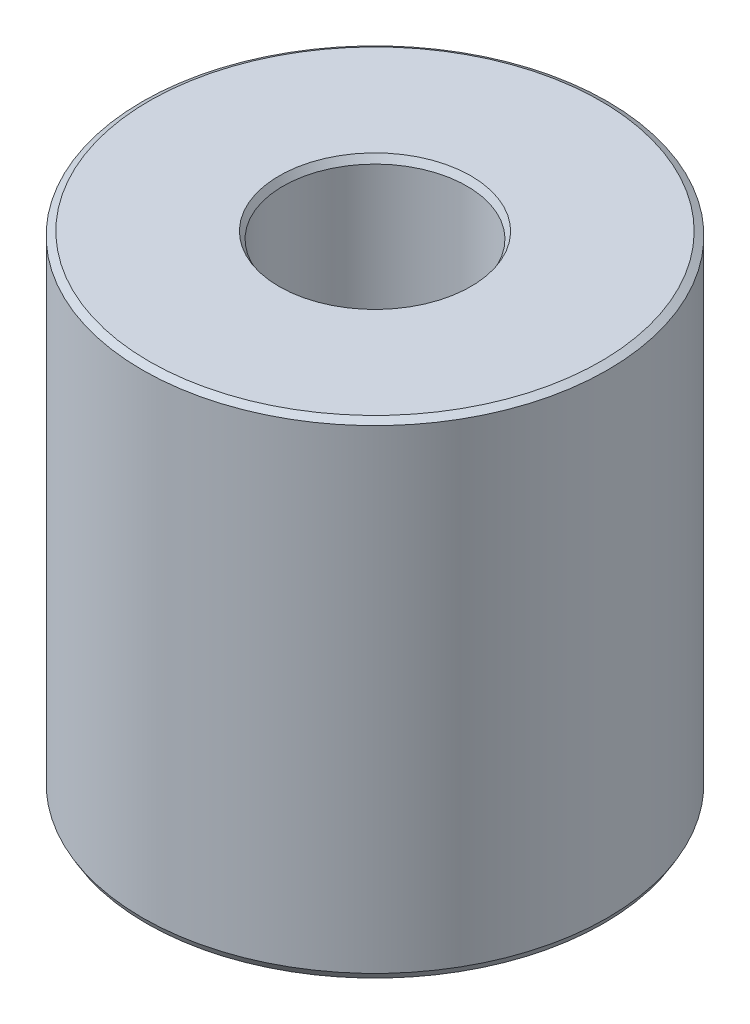
from build123d import *
from OCP.BRepFilletAPI import BRepFilletAPI_MakeChamfer

# Parameters (mm, degrees)
SKETCH1_R           = 50
BOSS_EXTRUDE1_DEPTH = 104.31964153
SKETCH2_R           = 19.763940978
CUT_EXTRUDE1_DEPTH  = 127.026138594
CHAMFER1_SIZE       = 0.853859272
CHAMFER1_SIZE2      = 1.478927642


with BuildPart() as part:
    # Sketch1 → Boss-Extrude1 (new body)
    with BuildSketch(Plane(origin=(0, 0, 0), x_dir=(1, 0, 0), z_dir=(0, 1, 0))):
        Circle(SKETCH1_R)
    extrude(amount=BOSS_EXTRUDE1_DEPTH)

    # Sketch2 → Cut-Extrude1 (cut, through all)
    with BuildSketch(Plane(origin=(0, 0, 0), x_dir=(1, 0, 0), z_dir=(0, 1, 0))):
        Circle(SKETCH2_R)
    extrude(amount=CUT_EXTRUDE1_DEPTH, mode=Mode.SUBTRACT)

    # Chamfer1: one chamfer whose edges measure the first distance from different faces: ONE call of the kernel's chamfer builder (chamfer() names one face for all edges)
    chamfer1_edges_1 = [part.edges().sort_by_distance(p)[0] for p in [
        (-19.763940978, 104.31964153, 0),
    ]]
    chamfer1_side_1 = [part.faces().sort_by_distance(p)[0] for p in [
        (-48.585786438, 104.31964153, 0),
    ]]
    chamfer1_edges_2 = [part.edges().sort_by_distance(p)[0] for p in [
        (-19.763940978, 0, 0),
    ]]
    chamfer1_side_2 = [part.faces().sort_by_distance(p)[0] for p in [
        (-19.763940978, 52.159820765, 0),
    ]]
    chamfer1_edges_3 = [part.edges().sort_by_distance(p)[0] for p in [
        (-50, 0, 0),
    ]]
    chamfer1_side_3 = [part.faces().sort_by_distance(p)[0] for p in [
        (-48.585786438, 0, 0),
    ]]
    chamfer1_edges_4 = [part.edges().sort_by_distance(p)[0] for p in [
        (-50, 104.31964153, 0),
    ]]
    chamfer1_side_4 = [part.faces().sort_by_distance(p)[0] for p in [
        (-50, 52.159820765, 0),
    ]]
    chamfer1 = BRepFilletAPI_MakeChamfer(part.part.solid().wrapped)
    for e in chamfer1_edges_1:
        chamfer1.Add(CHAMFER1_SIZE, CHAMFER1_SIZE2, e.wrapped, chamfer1_side_1[0].wrapped)  # the first distance lies on this face
    for e in chamfer1_edges_2:
        chamfer1.Add(CHAMFER1_SIZE, CHAMFER1_SIZE2, e.wrapped, chamfer1_side_2[0].wrapped)  # the first distance lies on this face
    for e in chamfer1_edges_3:
        chamfer1.Add(CHAMFER1_SIZE, CHAMFER1_SIZE2, e.wrapped, chamfer1_side_3[0].wrapped)  # the first distance lies on this face
    for e in chamfer1_edges_4:
        chamfer1.Add(CHAMFER1_SIZE, CHAMFER1_SIZE2, e.wrapped, chamfer1_side_4[0].wrapped)  # the first distance lies on this face
    add(Compound.cast(chamfer1.Shape()), mode=Mode.REPLACE)


solid = part.part
